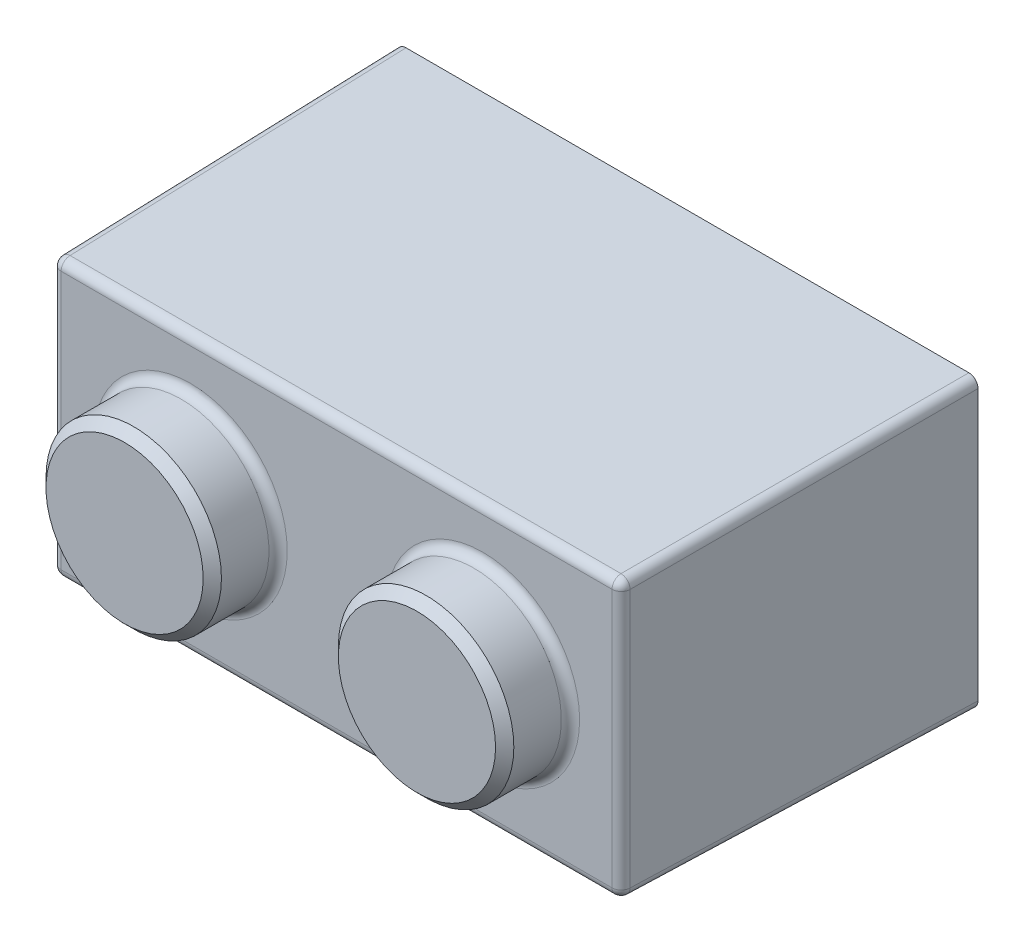
from build123d import *

# Parameters (mm, degrees)
SKETCH1_W            = 15.9
SKETCH1_H            = 7.9
MAIN_BODY_DEPTH      = 9.6
MAIN_BODY_TAPER      = 1
SKETCH2_R            = 2.4
POST_DEPTH           = 1.8
POST_LPATTERN1_COUNT = 2
POST_LPATTERN1_PITCH = 8
SHELL1_T             = -1.2
BODY_FILLET_R        = 0.25
POST_CHAMFER_SIZE    = 0.25


with BuildPart() as part:
    # Sketch1 → Main Body (new body)
    with BuildSketch(Plane.XY):
        with Locations((7.95, 3.95)):
            Rectangle(SKETCH1_W, SKETCH1_H)
    extrude(amount=MAIN_BODY_DEPTH, taper=MAIN_BODY_TAPER)

    # Sketch2 → Post (add)
    with BuildSketch(Plane.XY.offset(9.6)):
        with Locations((3.95, 3.95)):
            Circle(SKETCH2_R)
    post = extrude(amount=POST_DEPTH)

    # Post LPattern1: Post ×2
    with Locations(*[(i * POST_LPATTERN1_PITCH, 0, 0) for i in range(1, POST_LPATTERN1_COUNT)]):
        add(post)

    # Shell1
    shell1_openings = [part.faces().sort_by_distance(p)[0] for p in [
        (7.95, 3.95, 0),
    ]]
    offset(amount=SHELL1_T, openings=shell1_openings, kind=Kind.INTERSECTION)

    # Body Fillet
    body_fillet_edges = [part.edges().sort_by_distance(p)[0] for p in [
        (7.95, 7.732431377, 9.6),
        (15.732431377, 3.95, 9.6),
        (7.95, 0.167568623, 9.6),
        (0.167568623, 3.95, 9.6),
        (1.55, 3.95, 9.6),
        (9.55, 3.95, 9.6),
        (15.816215688, 7.816215688, 4.8),
        (15.816215688, 0.083784312, 4.8),
        (0.083784312, 7.816215688, 4.8),
        (0.083784312, 0.083784312, 4.8),
    ]]
    fillet(body_fillet_edges, radius=BODY_FILLET_R)

    # Post Chamfer
    post_chamfer_edges = [part.edges().sort_by_distance(p)[0] for p in [
        (1.55, 3.95, 11.4),
        (9.55, 3.95, 11.4),
    ]]
    chamfer(post_chamfer_edges, length=POST_CHAMFER_SIZE)


solid = part.part
